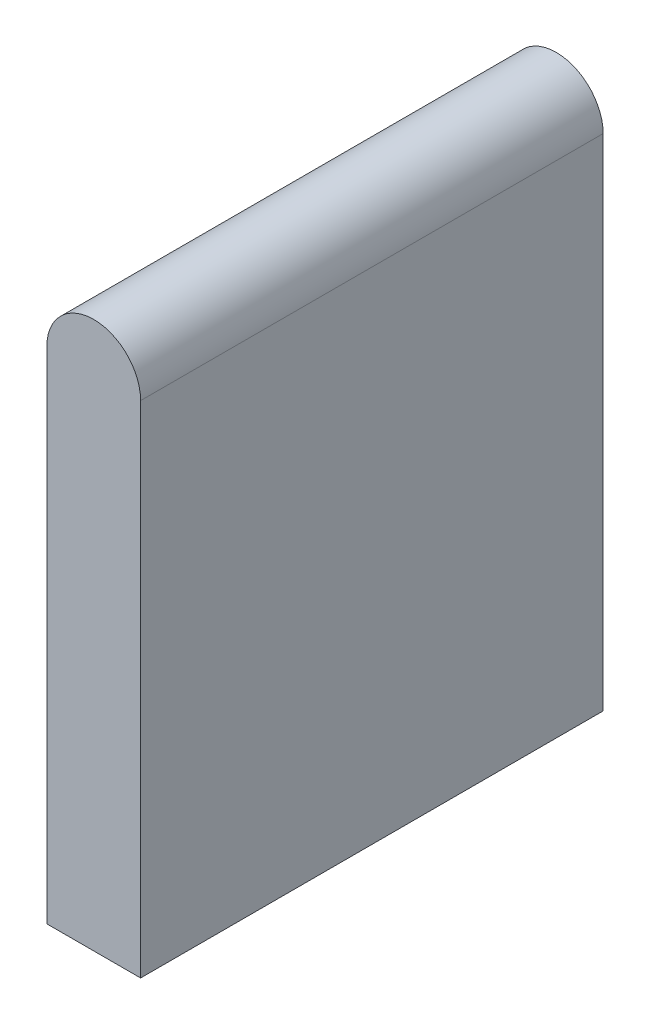
from build123d import *

# Parameters (mm, degrees)
BOSS_EXTRUDE1_DEPTH = 37


with BuildPart() as part:
    # Sketch1 → Boss-Extrude1 (new, symmetric)
    with BuildSketch(Plane.XY):
        with BuildLine():
            Line((7.5, 0), (7.5, -80))
            Line((7.5, -80), (-7.5, -80))
            Line((-7.5, -80), (-7.5, 0))
            ThreePointArc((-7.5, 0), (0, 7.5), (7.5, 0))
        make_face()
    extrude(amount=BOSS_EXTRUDE1_DEPTH, both=True)


solid = part.part
